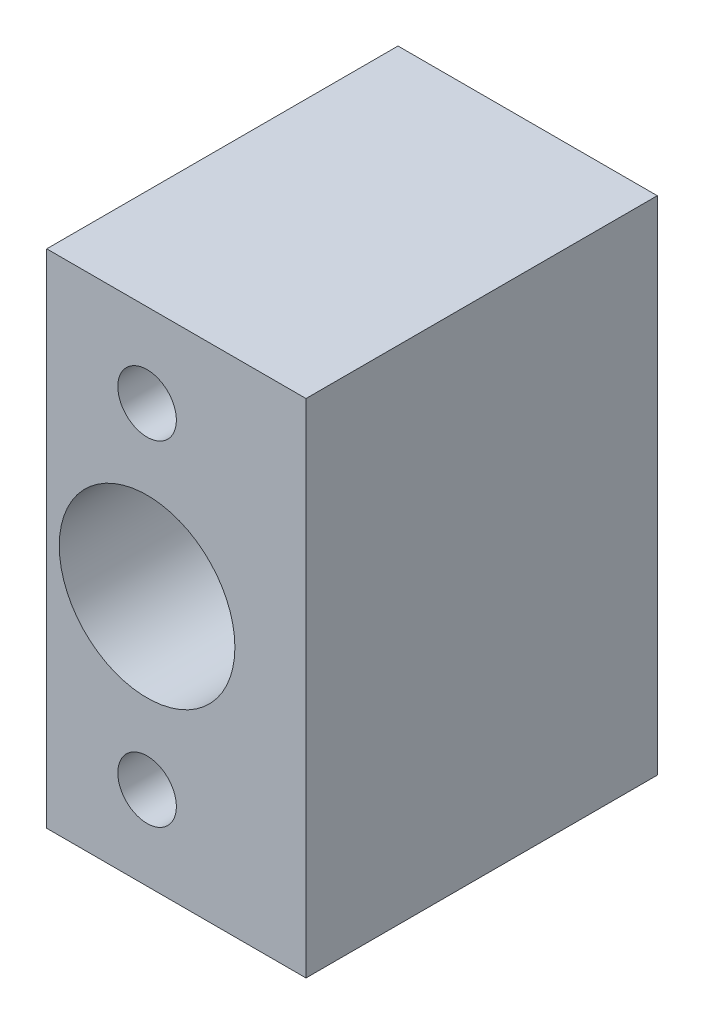
from build123d import *

# Parameters (mm, degrees)
SKETCH1_W               = 19
SKETCH1_H               = 30
BOSS_EXTRUDE1_DEPTH     = 18
SKETCH2_R               = 5.25
CUT_EXTRUDE1_DEPTH      = 11.5
SKETCH4_R               = 4.8
CUT_EXTRUDE3_DEPTH      = 1
CUT_EXTRUDE4_DEPTH      = 22.714050751
CUT_EXTRUDE4_DEPTH_BACK = 8
SKETCH5_R               = 2.36
CUT_EXTRUDE6_DEPTH      = 26.28339376
CUT_EXTRUDE6_DEPTH_BACK = 26.28339376
SKETCH11_W              = 15.5
SKETCH11_H              = 30
BOSS_EXTRUDE5_DEPTH     = 5
SKETCH12_R              = 4
CUT_EXTRUDE8_DEPTH      = 5
SKETCH13_R              = 1.75
CUT_EXTRUDE9_DEPTH      = 30.055980452
SKETCH14_R              = 3
CUT_EXTRUDE10_DEPTH     = 1
SKETCH15_W              = 15.5
SKETCH15_H              = 2
CUT_EXTRUDE11_DEPTH     = 41
SKETCH17_R              = 5
CUT_EXTRUDE12_DEPTH     = 2
SKETCH20_R              = 3.81
CUT_EXTRUDE13_DEPTH     = 9


with BuildPart() as part:
    # Sketch1 → Boss-Extrude1 (new body)
    with BuildSketch(Plane.XY):
        Rectangle(SKETCH1_W, SKETCH1_H)
    extrude(amount=BOSS_EXTRUDE1_DEPTH)

    # Sketch2 → Cut-Extrude1 (cut)
    with BuildSketch(Plane.XY.offset(18)):
        Circle(SKETCH2_R)
    extrude(amount=-CUT_EXTRUDE1_DEPTH, mode=Mode.SUBTRACT)

    # Sketch4 → Cut-Extrude3 (cut)
    with BuildSketch(Plane.XY.offset(6.5)):
        Circle(SKETCH4_R)
    extrude(amount=-CUT_EXTRUDE3_DEPTH, mode=Mode.SUBTRACT)

    # Sketch5 → Cut-Extrude4 (cut, two sides: drawn at the far end of the back side and taken through both)
    with BuildSketch(Plane.XY.offset(5.5).offset(-CUT_EXTRUDE4_DEPTH_BACK)):
        Circle(SKETCH5_R)
    extrude(amount=CUT_EXTRUDE4_DEPTH + CUT_EXTRUDE4_DEPTH_BACK, mode=Mode.SUBTRACT)

    # Sketch6 → Cut-Extrude6 (cut, two sides: drawn at the far end of the back side and taken through both)
    with BuildSketch(Plane.XY.offset(-CUT_EXTRUDE6_DEPTH_BACK)):
        Polygon((-6, 92.53517602), (-6, 15), (-6, -15), (-6, -92.53517602), (-161.070352039, -92.53517602), (-161.070352039, 92.53517602), align=None)
    extrude(amount=CUT_EXTRUDE6_DEPTH + CUT_EXTRUDE6_DEPTH_BACK, mode=Mode.SUBTRACT)

    # Sketch11 → Boss-Extrude5 (add)
    with BuildSketch(Plane(origin=(0, 0, 0), x_dir=(-1, 0, 0), z_dir=(0, 0, -1))):
        with Locations((-1.75, 0)):
            Rectangle(SKETCH11_W, SKETCH11_H)
    extrude(amount=BOSS_EXTRUDE5_DEPTH)

    # Sketch12 → Cut-Extrude8 (cut)
    with BuildSketch(Plane(origin=(0, 0, -5), x_dir=(-1, 0, 0), z_dir=(0, 0, -1))):
        Circle(SKETCH12_R)
    extrude(amount=-CUT_EXTRUDE8_DEPTH, mode=Mode.SUBTRACT)

    # Sketch13 → Cut-Extrude9 (cut, through all)
    with BuildSketch(Plane(origin=(0, 0, -5), x_dir=(-1, 0, 0), z_dir=(0, 0, -1))):
        with Locations((0, -10)):
            Circle(SKETCH13_R)
        with Locations((0, 10)):
            Circle(SKETCH13_R)
    extrude(amount=-CUT_EXTRUDE9_DEPTH, mode=Mode.SUBTRACT)

    # Sketch14 → Cut-Extrude10 (cut)
    with BuildSketch(Plane.XY.offset(5.5)):
        Circle(SKETCH14_R)
    extrude(amount=-CUT_EXTRUDE10_DEPTH, mode=Mode.SUBTRACT)

    # Sketch15 → Cut-Extrude11 (cut)
    with BuildSketch(Plane.XZ.offset(15)):
        with Locations((1.75, 17)):
            Rectangle(SKETCH15_W, SKETCH15_H)
    extrude(amount=-CUT_EXTRUDE11_DEPTH, mode=Mode.SUBTRACT)

    # Sketch17 → Cut-Extrude12 (cut)
    with BuildSketch(Plane(origin=(-6, -15, -5), x_dir=(0.9209034917442324, -0.31932895127596433, -0.22353026589317507), z_dir=(0.38979066034639764, 0.7544335361543176, 0.5281034753080227))):
        Circle(SKETCH17_R)
    extrude(amount=CUT_EXTRUDE12_DEPTH, mode=Mode.SUBTRACT)

    # Sketch20 → Cut-Extrude13 (cut)
    with BuildSketch(Plane(origin=(0, 0, -5), x_dir=(-1, 0, 0), z_dir=(0, 0, -1))):
        with Locations((0, 10)):
            Circle(SKETCH20_R)
        with Locations((0, -10)):
            Circle(SKETCH20_R)
    extrude(amount=-CUT_EXTRUDE13_DEPTH, mode=Mode.SUBTRACT)


solid = part.part
